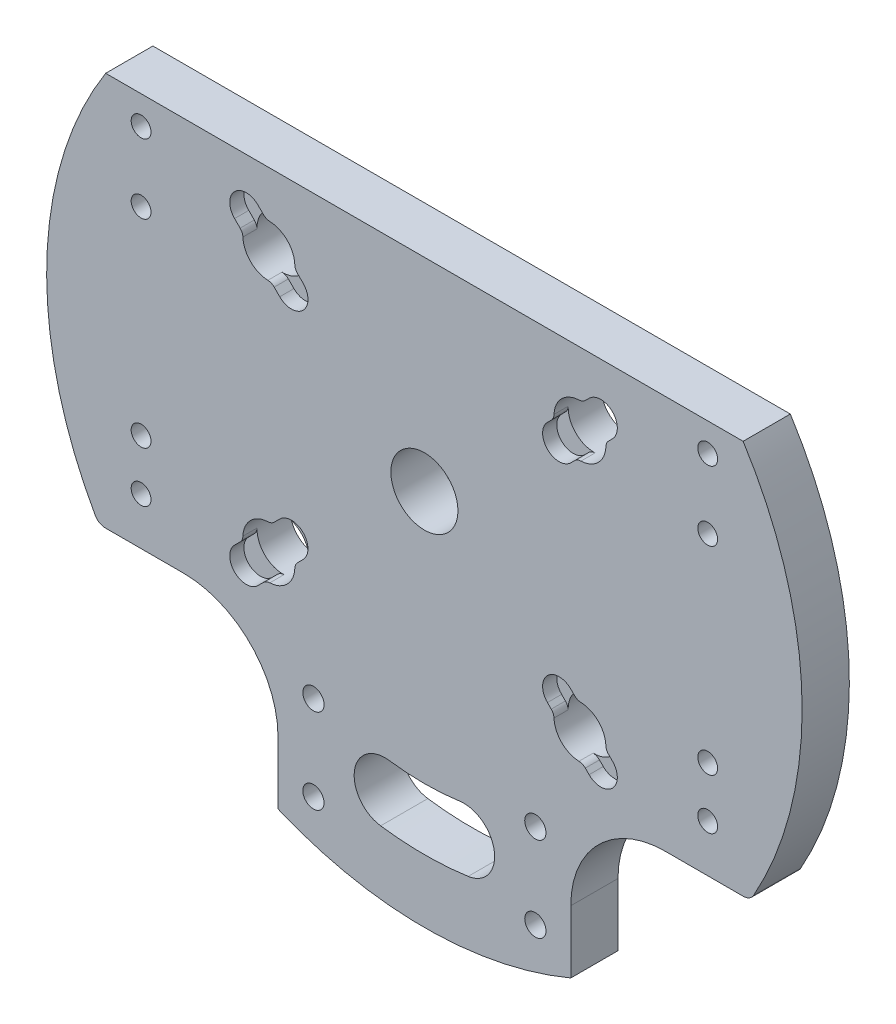
from build123d import *

# Parameters (mm, degrees)
EXTRUDE_2_DEPTH      = 10
SKETCH_6_R           = 2.5
CUT_EXTRUDE_1_DEPTH  = 8
SKETCH_7_R           = 5.5
CUT_EXTRUDE_2_DEPTH  = 114.578166916
CUT_EXTRUDE_3_DEPTH  = 114.578166916
CUT_EXTRUDE_4_DEPTH  = 3
FILLET_1_R           = 2
CUT_EXTRUDE_7_DEPTH  = 114.578166916
SKETCH_16_R          = 3.5
CUT_EXTRUDE_8_DEPTH  = 3
SKETCH_18_R          = 2.1
CUT_EXTRUDE_9_DEPTH  = 114.578166916
FILLET_2_R           = 20
FILLET_3_R           = 2.5
SKETCH_20_R          = 3.75
CUT_EXTRUDE_11_DEPTH = 3
SKETCH_21_R          = 2.25
CUT_EXTRUDE_12_DEPTH = 114.578166916
SKETCH_22_R          = 7.1
CUT_EXTRUDE_13_DEPTH = 114.578166916


with BuildPart() as part:
    # 草图5 → 凸台-拉伸2 (new body)
    with BuildSketch(Plane.XY):
        with BuildLine():
            Line((-67.5, 42.938910093), (67.5, 42.938910093))
            ThreePointArc((67.5, 42.938910093), (0, -80), (-67.5, 42.938910093))
        make_face()
    extrude(amount=EXTRUDE_2_DEPTH)

    # 草图6 → 切除-拉伸1 (cut)
    with BuildSketch(Plane(origin=(0, 0, 0), x_dir=(-1, 0, 0), z_dir=(0, 0, -1))):
        with Locations(Location((-51.961524227, 30, 0), (0, 0, 180))):
            Circle(SKETCH_6_R)
        with Locations((-51.961524227, -30)):
            Circle(SKETCH_6_R)
        with Locations((51.961524227, -30)):
            Circle(SKETCH_6_R)
        with Locations(Location((51.961524227, 30, 0), (0, 0, 180))):
            Circle(SKETCH_6_R)
    extrude(amount=-CUT_EXTRUDE_1_DEPTH, mode=Mode.SUBTRACT)

    # 草图7 → 切除-拉伸2 (cut, through all)
    with BuildSketch(Plane(origin=(0, 0, 0), x_dir=(-1, 0, 0), z_dir=(0, 0, -1))):
        with Locations((32.939911054, -27.639867217)):
            Circle(SKETCH_7_R)
        with Locations((32.939911054, 27.639867217)):
            Circle(SKETCH_7_R)
        with Locations((-32.946514438, 27.631995701)):
            Circle(SKETCH_7_R)
        with Locations((-32.946514438, -27.631995701)):
            Circle(SKETCH_7_R)
    extrude(amount=-CUT_EXTRUDE_2_DEPTH, mode=Mode.SUBTRACT)

    # 草图8 → 切除-拉伸3 (cut, through all)
    with BuildSketch(Plane.XY.offset(10)):
        with BuildLine():
            ThreePointArc((-9.2723103, -65.975915967), (0, -66.624299065), (9.2723103, -65.975915967))
            ThreePointArc((9.2723103, -65.975915967), (14.814767997, -58.620826181), (7.459678211, -53.078368485))
            ThreePointArc((7.459678211, -53.078368485), (0, -53.6), (-7.459678211, -53.078368485))
            ThreePointArc((-7.459678211, -53.078368485), (-14.814767997, -58.620826181), (-9.2723103, -65.975915967))
        make_face()
    extrude(amount=-CUT_EXTRUDE_3_DEPTH, mode=Mode.SUBTRACT)

    # 草图9 → 切除-拉伸4 (cut)
    with BuildSketch(Plane.XY.offset(10)):
        with BuildLine():
            Line((-35.246116648, 34.895820279), (-25.683957992, 25.333661623))
            ThreePointArc((-25.683957992, 25.333661623), (-25.683957992, 20.383914155), (-30.63370546, 20.383914155))
            Line((-30.63370546, 20.383914155), (-40.195864116, 29.94607281))
            ThreePointArc((-40.195864116, 29.94607281), (-40.195864116, 34.895820279), (-35.246116648, 34.895820279))
        make_face()
        with BuildLine():
            Line((39.832192061, 29.567925856), (31.010584282, 20.746318078))
            ThreePointArc((31.010584282, 20.746318078), (26.060836814, 20.746318078), (26.060836814, 25.696065546))
            Line((26.060836814, 25.696065546), (34.882444593, 34.517673324))
            ThreePointArc((34.882444593, 34.517673324), (39.832192061, 34.517673324), (39.832192061, 29.567925856))
        make_face()
        with BuildLine():
            Line((-35.246116648, -34.895820279), (-25.683957992, -25.333661623))
            ThreePointArc((-25.683957992, -25.333661623), (-25.683957992, -20.383914155), (-30.63370546, -20.383914155))
            Line((-30.63370546, -20.383914155), (-40.195864116, -29.94607281))
            ThreePointArc((-40.195864116, -29.94607281), (-40.195864116, -34.895820279), (-35.246116648, -34.895820279))
        make_face()
        with BuildLine():
            Line((39.832192061, -29.567925856), (31.010584282, -20.746318078))
            ThreePointArc((31.010584282, -20.746318078), (26.060836814, -20.746318078), (26.060836814, -25.696065546))
            Line((26.060836814, -25.696065546), (34.882444593, -34.517673324))
            ThreePointArc((34.882444593, -34.517673324), (39.832192061, -34.517673324), (39.832192061, -29.567925856))
        make_face()
    extrude(amount=-CUT_EXTRUDE_4_DEPTH, mode=Mode.SUBTRACT)

    # 圆角1
    # the kernel refuses this fillet: 2 mm, written as the material it takes off along each edge
    with BuildSketch(Plane(origin=(32.421388172, -22.157121967, 12.140947066), x_dir=(0.9995822889813627, 0.028900649729367227, 0), z_dir=(0, 0, -1)), Plane(origin=(33.471640703, -33.106869435, 12.140947066), x_dir=(-0.9995822889813627, -0.028900649729367227, 0), z_dir=(0, 0, -1)), Plane(origin=(38.421388172, 28.157121967, 12.140947066), x_dir=(0.028900649729366526, -0.9995822889813627, 0), z_dir=(0, 0, -1)), Plane(origin=(27.471640703, 27.106869435, 12.140947066), x_dir=(-0.028900649729366384, 0.9995822889813627, 0), z_dir=(0, 0, -1)), Plane(origin=(-33.46503732, 33.114740951, 12.140947066), x_dir=(0.9995822889813627, 0.028900649729368344, 0), z_dir=(0, 0, -1)), Plane(origin=(-32.414784788, 22.164993482, 12.140947066), x_dir=(-0.9995822889813627, -0.028900649729368344, 0), z_dir=(0, 0, -1)), Plane(origin=(-27.46503732, -27.114740951, 12.140947066), x_dir=(0.028900649729362526, -0.9995822889813628, 0), z_dir=(0, 0, -1)), Plane(origin=(-38.414784788, -28.164993482, 12.140947066), x_dir=(-0.028900649729357547, 0.9995822889813629, 0), z_dir=(0, 0, -1))) as fillet_1_piece_1:
        with BuildLine():
            CenterArc((0.866697016, -1.995550294), FILLET_1_R, 93.822687788, 42.833428066)
            Line((-0.587797505, -0.622799155), (0, 0))
            ThreePointArc((0, 0), (0.366679507, -0.012236691), (0.733359013, 0))
        make_face()
    extrude(amount=5.140947066, mode=Mode.SUBTRACT)
    with BuildSketch(Plane(origin=(27.471640703, -27.106869435, 12.140947066), x_dir=(-0.028900649729367366, -0.9995822889813627, 0), z_dir=(0, 0, -1)), Plane(origin=(38.421388172, -28.157121967, 12.140947066), x_dir=(0.028900649729367924, 0.9995822889813627, 0), z_dir=(0, 0, -1)), Plane(origin=(33.471640703, 33.106869435, 12.140947066), x_dir=(-0.9995822889813627, 0.028900649729367227, 0), z_dir=(0, 0, -1)), Plane(origin=(32.421388172, 22.157121967, 12.140947066), x_dir=(0.9995822889813627, -0.028900649729367227, 0), z_dir=(0, 0, -1)), Plane(origin=(-38.414784788, 28.164993482, 12.140947066), x_dir=(-0.028900649729367647, -0.9995822889813627, 0), z_dir=(0, 0, -1)), Plane(origin=(-27.46503732, 27.114740951, 12.140947066), x_dir=(0.028900649729362664, 0.9995822889813628, 0), z_dir=(0, 0, -1)), Plane(origin=(-32.414784788, -22.164993482, 12.140947066), x_dir=(-0.9995822889813627, 0.028900649729368066, 0), z_dir=(0, 0, -1)), Plane(origin=(-33.46503732, -33.114740951, 12.140947066), x_dir=(0.9995822889813627, -0.028900649729367785, 0), z_dir=(0, 0, -1))) as fillet_1_piece_2:
        with BuildLine():
            CenterArc((0.866697016, 1.995550294), FILLET_1_R, 223.343884146, 42.833428066)
            Line((-0.587797505, 0.622799155), (0, 0))
            ThreePointArc((0, 0), (0.366679507, 0.012236691), (0.733359013, 0))
        make_face()
    extrude(amount=5.140947066, mode=Mode.SUBTRACT)

    # 草图13 → 切除-拉伸7 (cut, through all)
    with BuildSketch(Plane.XY.offset(10)):
        with BuildLine():
            Line((-31, -40.5), (-64.208177049, -40.5))
            Line((-64.208177049, -40.5), (-68.990941434, -40.5))
            ThreePointArc((-68.990941434, -40.5), (-52.687101579, -60.200243581), (-31, -73.74957627))
            Line((-31, -73.74957627), (-31, -40.5))
        make_face()
        with BuildLine():
            Line((31, -40.5), (31, -73.74957627))
            ThreePointArc((31, -73.74957627), (52.687101579, -60.200243581), (68.990941434, -40.5))
            Line((68.990941434, -40.5), (31, -40.5))
        make_face()
    extrude(amount=-CUT_EXTRUDE_7_DEPTH, mode=Mode.SUBTRACT)

    # 草图16 → 切除-拉伸8 (cut)
    with BuildSketch(Plane(origin=(0, 0, 0), x_dir=(-1, 0, 0), z_dir=(0, 0, -1))):
        with Locations((60, 36.938910093)):
            Circle(SKETCH_16_R)
        with Locations((60, 22.238910093)):
            Circle(SKETCH_16_R)
        with Locations((60, -19.761089907)):
            Circle(SKETCH_16_R)
        with Locations((60, -30.461089907)):
            Circle(SKETCH_16_R)
    cut_extrude_8 = extrude(amount=-CUT_EXTRUDE_8_DEPTH, mode=Mode.SUBTRACT)

    # 草图18 → 切除-拉伸9 (cut, through all)
    with BuildSketch(Plane(origin=(0, 0, 0), x_dir=(-1, 0, 0), z_dir=(0, 0, -1))):
        with Locations((60, -30.461089907)):
            Circle(SKETCH_18_R)
        with Locations((60, -19.761089907)):
            Circle(SKETCH_18_R)
        with Locations((60, 22.238910093)):
            Circle(SKETCH_18_R)
        with Locations((60, 36.938910093)):
            Circle(SKETCH_18_R)
    cut_extrude_9 = extrude(amount=-CUT_EXTRUDE_9_DEPTH, mode=Mode.SUBTRACT)

    # 镜向1: 切除-拉伸8, 切除-拉伸9 across plane
    add(cut_extrude_8.mirror(Plane(origin=(0, 0, 0), x_dir=(0, 0, 1), z_dir=(1, 0, 0))), mode=Mode.SUBTRACT)
    add(cut_extrude_9.mirror(Plane(origin=(0, 0, 0), x_dir=(0, 0, 1), z_dir=(1, 0, 0))), mode=Mode.SUBTRACT)

    # 圆角2
    fillet_2_edges = [part.edges().sort_by_distance(p)[0] for p in [
        (-31, -40.5, 5),
        (31, -40.5, 5),
    ]]
    fillet(fillet_2_edges, radius=FILLET_2_R)

    # 圆角3
    fillet_3_edges = [part.edges().sort_by_distance(p)[0] for p in [
        (-68.990941434, -40.5, 5),
        (68.990941434, -40.5, 5),
    ]]
    fillet(fillet_3_edges, radius=FILLET_3_R)

    # 草图20 → 切除-拉伸11 (cut)
    with BuildSketch(Plane(origin=(0, 0, 0), x_dir=(-1, 0, 0), z_dir=(0, 0, -1))):
        with Locations((23.5, -67.74957627)):
            Circle(SKETCH_20_R)
        with Locations((23.5, -49.74957627)):
            Circle(SKETCH_20_R)
    cut_extrude_11 = extrude(amount=-CUT_EXTRUDE_11_DEPTH, mode=Mode.SUBTRACT)

    # 草图21 → 切除-拉伸12 (cut, through all)
    with BuildSketch(Plane(origin=(0, 0, 0), x_dir=(-1, 0, 0), z_dir=(0, 0, -1))):
        with Locations((23.5, -49.74957627)):
            Circle(SKETCH_21_R)
        with Locations((23.5, -67.74957627)):
            Circle(SKETCH_21_R)
    cut_extrude_12 = extrude(amount=-CUT_EXTRUDE_12_DEPTH, mode=Mode.SUBTRACT)

    # 镜向2: 切除-拉伸11, 切除-拉伸12 across plane
    add(cut_extrude_11.mirror(Plane(origin=(0, 0, 0), x_dir=(0, 0, 1), z_dir=(1, 0, 0))), mode=Mode.SUBTRACT)
    add(cut_extrude_12.mirror(Plane(origin=(0, 0, 0), x_dir=(0, 0, 1), z_dir=(1, 0, 0))), mode=Mode.SUBTRACT)

    # 草图22 → 切除-拉伸13 (cut, through all)
    with BuildSketch(Plane(origin=(0, 0, 0), x_dir=(-1, 0, 0), z_dir=(0, 0, -1))):
        Circle(SKETCH_22_R)
    extrude(amount=-CUT_EXTRUDE_13_DEPTH, mode=Mode.SUBTRACT)


solid = part.part
